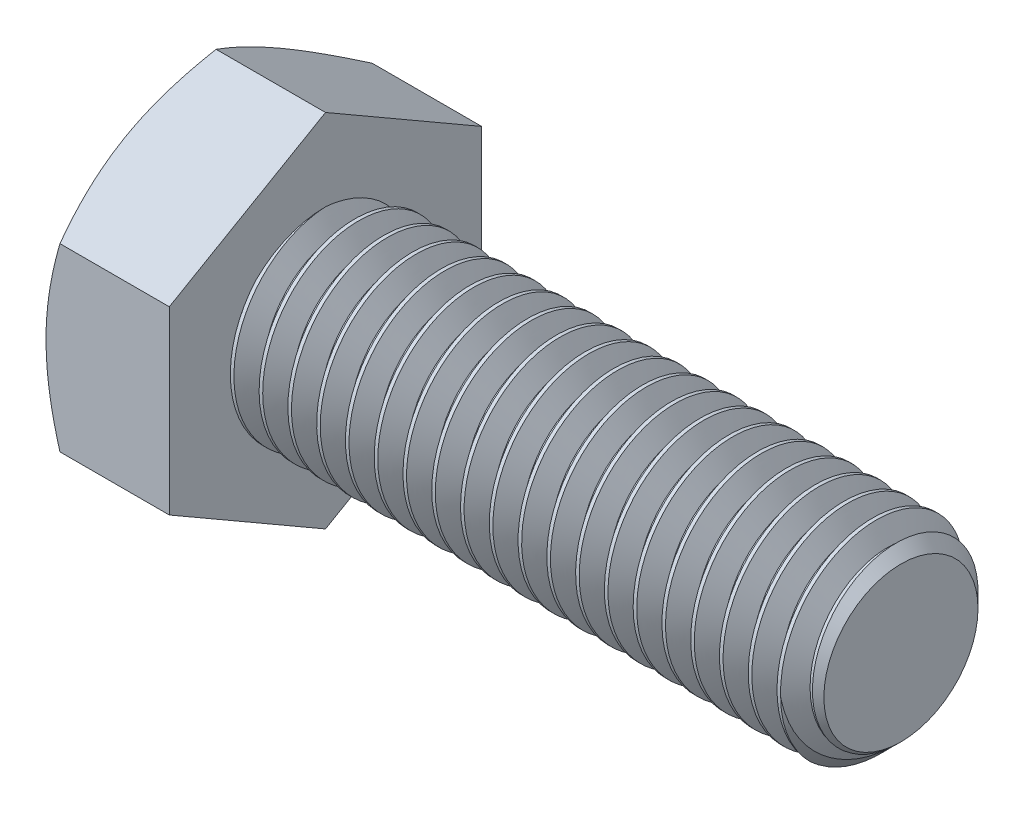
from build123d import *

# Parameters (mm, degrees)
SKETCH2_R           = 6
BOSS_EXTRUDE1_DEPTH = 35
CHAMFER1_SIZE       = 1.3125
CUT_SWEEP1_PITCH    = 1.75
BOSS_EXTRUDE2_DEPTH = 7.5
SKETCH6_OUTSIDE_W   = 190.326
SKETCH6_OUTSIDE_H   = 193.266
SKETCH6_OUTSIDE_R   = 9.5
CUT_EXTRUDE1_DEPTH  = 45.909167727
CUT_EXTRUDE1_DRAFT  = -60


with BuildPart() as part:
    # Sketch2 → Boss-Extrude1 (new body)
    with BuildSketch(Plane(origin=(21.25, 0, 0), x_dir=(0, 0, -1), z_dir=(1, 0, 0))):
        Circle(SKETCH2_R)
    extrude(amount=-BOSS_EXTRUDE1_DEPTH)

    # Chamfer1
    chamfer1_edges = [part.edges().sort_by_distance(p)[0] for p in [
        (21.25, 0, 6),
    ]]
    chamfer(chamfer1_edges, length=CHAMFER1_SIZE)

    # Cut-Sweep1: the profile of Sketch5 profile screwed along a right-hand helix of 21 turns, 10 arcs to a turn; built about Z, then put on its axis
    cut_sweep1_z = Axis((0, 0, 0), (0, 0, 1))
    cut_sweep1_corners = [(6.0003, 0, 0.000173205), (4.863341658, 0, -0.65625), (4.863341658, 0, -0.875), (6.0003, 0, -1.531423205)]
    with BuildLine(mode=Mode.PRIVATE) as cut_sweep1_profile:
        Line(cut_sweep1_corners[0], cut_sweep1_corners[1])
        Line(cut_sweep1_corners[1], cut_sweep1_corners[2])
        Line(cut_sweep1_corners[2], cut_sweep1_corners[3])
        Line(cut_sweep1_corners[3], cut_sweep1_corners[0])
    cut_sweep1_cap = Face(cut_sweep1_profile.wire())
    cut_sweep1_turn_angles = [0, 18, 36, 54, 72, 90, 108, 126, 144, 162, 180, 198, 216, 234, 252, 270, 288, 306, 324, 342, 360]
    cut_sweep1_turn_weights = [1, 0.9510565162951535, 1, 0.9510565162951535, 1, 0.9510565162951535, 1, 0.9510565162951535, 1, 0.9510565162951535, 1, 0.9510565162951535, 1, 0.9510565162951535, 1, 0.9510565162951535, 1, 0.9510565162951535, 1, 0.9510565162951535, 1]
    cut_sweep1_turn_rails = [Edge.make_bspline([Vector(p[0], p[1], 0).rotate(cut_sweep1_z, cut_sweep1_turn_angles[k]) / cut_sweep1_turn_weights[k] + Vector(0, 0, p[2] + CUT_SWEEP1_PITCH * cut_sweep1_turn_angles[k] / 360) for k in range(21)], [0, 0, 0, 1, 1, 2, 2, 3, 3, 4, 4, 5, 5, 6, 6, 7, 7, 8, 8, 9, 9, 10, 10, 10], 2, cut_sweep1_turn_weights) for p in cut_sweep1_corners]
    cut_sweep1_turn_sides = [Face.make_surface_from_curves(cut_sweep1_turn_rails[p[0]], cut_sweep1_turn_rails[p[1]]) for p in [(0, 1), (1, 2), (2, 3), (3, 0)]]
    cut_sweep1 = Plane(origin=(21.25, 0, 0), x_dir=(0, 1, 0), z_dir=(-1, 0, 0)) * Solid(Shell([*[p.moved(Location((0, 0, CUT_SWEEP1_PITCH * i))) for i in range(21) for p in cut_sweep1_turn_sides], cut_sweep1_cap, cut_sweep1_cap.rotate(cut_sweep1_z, 7560).moved(Location((0, 0, CUT_SWEEP1_PITCH * 7560 / 360)))]))
    add(cut_sweep1, mode=Mode.SUBTRACT)

    # Sketch3 → Boss-Extrude2 (add)
    with BuildSketch(Plane.ZY.offset(13.75)):
        Polygon((-9.5, -5.484827557), (0, -10.969655115), (9.5, -5.484827557), (9.5, 5.484827557), (0, 10.969655115), (-9.5, 5.484827557), align=None)
    extrude(amount=BOSS_EXTRUDE2_DEPTH)


with BuildPart() as cut_extrude1_tool:
    # Sketch6 outside → Cut-Extrude1 (with draft: the straight prism first)
    with BuildSketch(Plane.ZY.offset(21.25)):
        Rectangle(SKETCH6_OUTSIDE_W, SKETCH6_OUTSIDE_H)
        Circle(SKETCH6_OUTSIDE_R, mode=Mode.SUBTRACT)
    extrude(amount=-CUT_EXTRUDE1_DEPTH)
    # Cut-Extrude1: the draft: its side faces are tilted about the plane it starts from
    cut_extrude1_sides = [cut_extrude1_tool.faces().sort_by_distance(p)[0] for p in [
        (1.704583863, -96.633, 0),
        (1.704583863, 0, 95.163),
        (1.704583863, 96.633, 0),
        (1.704583863, 0, -95.163),
        (1.704583863, 0, -9.5),
    ]]
    draft(cut_extrude1_sides, Plane.ZY.offset(21.25), CUT_EXTRUDE1_DRAFT)


with BuildPart() as part_1:
    add(part.part)

    # Cut-Extrude1: cut by cut_extrude1_tool
    add(cut_extrude1_tool.part, mode=Mode.SUBTRACT)


solid = part_1.part
